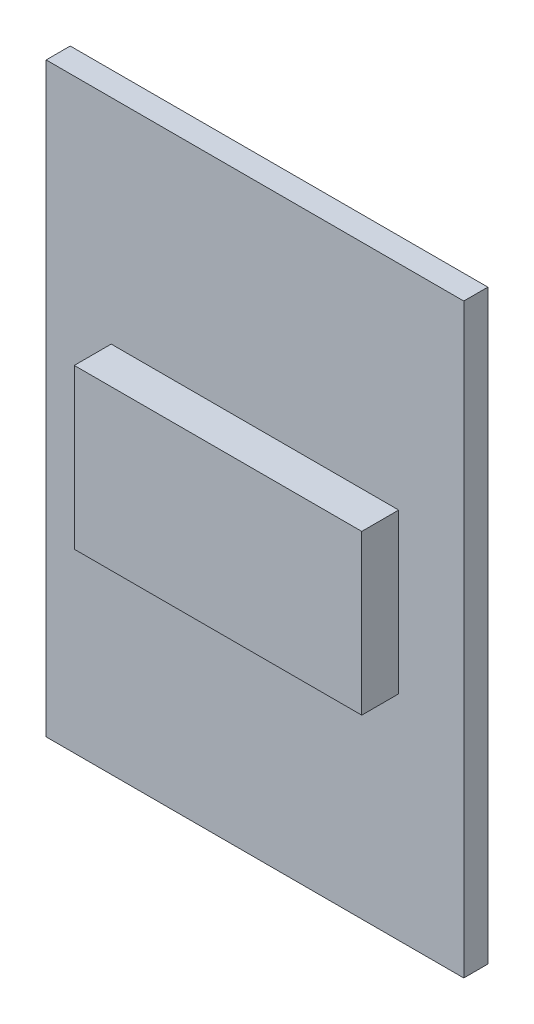
from build123d import *

# Parameters (mm, degrees)
CROQUIS1_W              = 26
CROQUIS1_H              = 36.5
SALIENTE_EXTRUIR1_DEPTH = 1.5
CROQUIS2_W              = 17.897626928
CROQUIS2_H              = 9.909420558
SALIENTE_EXTRUIR2_DEPTH = 2.3


with BuildPart() as part:
    # Croquis1 → Saliente-Extruir1 (new body)
    with BuildSketch(Plane.XY):
        Rectangle(CROQUIS1_W, CROQUIS1_H)
    extrude(amount=SALIENTE_EXTRUIR1_DEPTH)

    # Croquis2 → Saliente-Extruir2 (add)
    with BuildSketch(Plane.XY.offset(1.5)):
        Rectangle(CROQUIS2_W, CROQUIS2_H)
    extrude(amount=SALIENTE_EXTRUIR2_DEPTH)


solid = part.part
